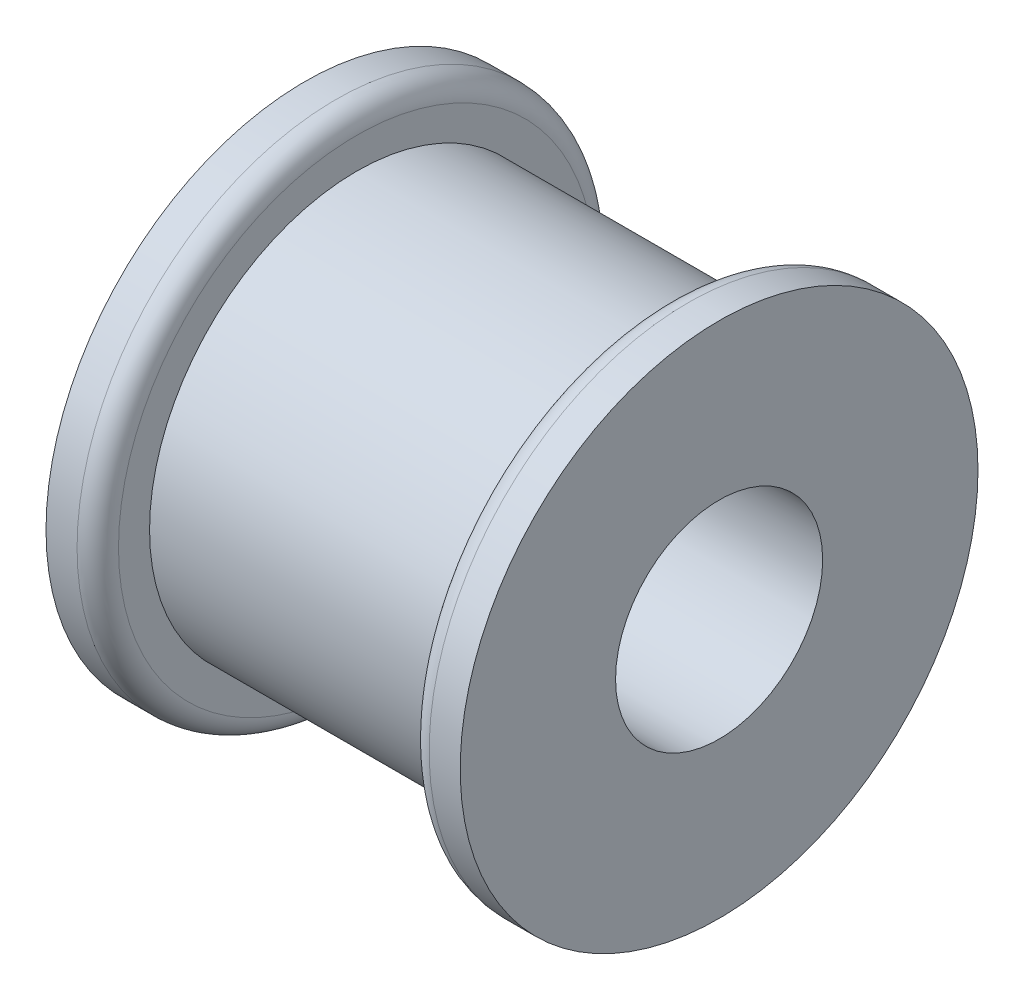
from build123d import *

# Parameters (mm, degrees)
SKETCH1_R           = 12.7
BOSS_EXTRUDE1_DEPTH = 19.05
SKETCH2_R           = 15.875
BOSS_EXTRUDE2_DEPTH = 3.175
BOSS_EXTRUDE3_START = 3.175
SKETCH3_R           = 15.875
BOSS_EXTRUDE3_DEPTH = 3.175
SKETCH4_R           = 6.35
CUT_EXTRUDE1_DEPTH  = 34.89972345
FILLET1_R           = 1.27


with BuildPart() as part:
    # Sketch1 → Boss-Extrude1 (new body)
    with BuildSketch(Plane(origin=(0, 0, 0), x_dir=(0, 0, -1), z_dir=(1, 0, 0))):
        Circle(SKETCH1_R)
    extrude(amount=BOSS_EXTRUDE1_DEPTH)

    # Sketch2 → Boss-Extrude2 (add)
    with BuildSketch(Plane.ZY):
        Circle(SKETCH2_R)
    extrude(amount=BOSS_EXTRUDE2_DEPTH)

    # Sketch3 → Boss-Extrude3 (add)
    with BuildSketch(Plane(origin=(19.05, 0, 0), x_dir=(0, 0, -1), z_dir=(1, 0, 0)).offset(BOSS_EXTRUDE3_START)):
        Circle(SKETCH3_R)
    extrude(amount=-BOSS_EXTRUDE3_DEPTH)

    # Sketch4 → Cut-Extrude1 (cut, through all)
    with BuildSketch(Plane.ZY.offset(3.175)):
        Circle(SKETCH4_R)
    extrude(amount=-CUT_EXTRUDE1_DEPTH, mode=Mode.SUBTRACT)

    # Fillet1
    fillet1_edges = [part.edges().sort_by_distance(p)[0] for p in [
        (0, 0, -15.875),
        (19.05, 0, 15.875),
    ]]
    fillet(fillet1_edges, radius=FILLET1_R)


solid = part.part
